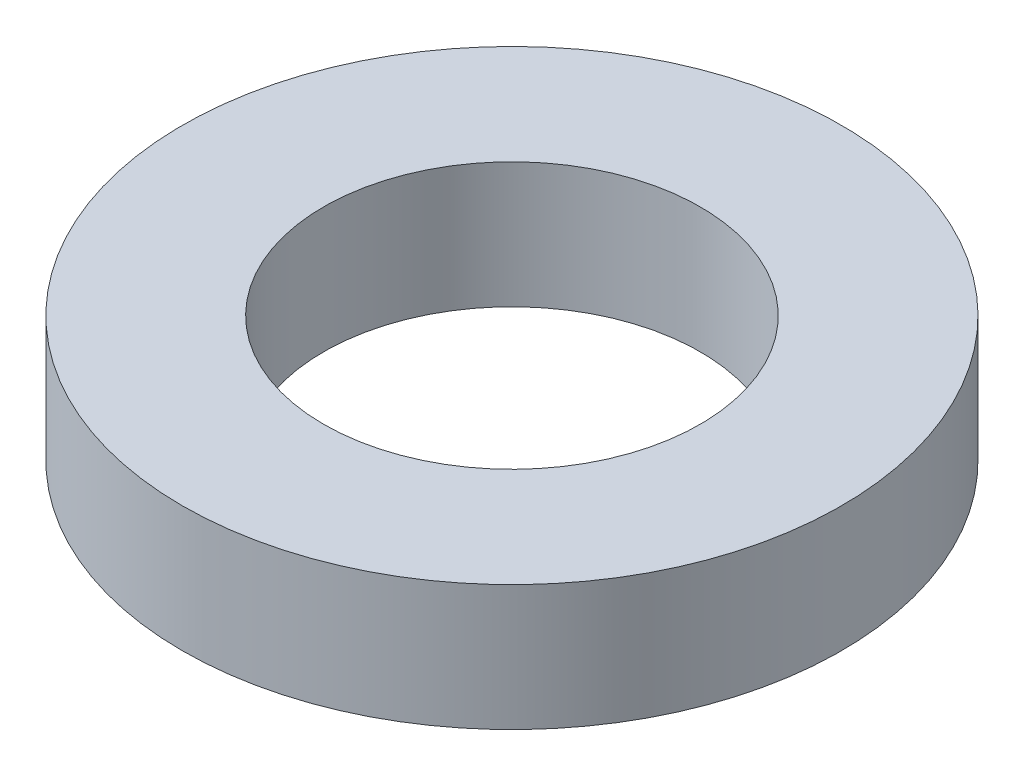
from build123d import *

# Parameters (mm, degrees)
SKETCH1_R           = 52.5
BOSS_EXTRUDE1_DEPTH = 20
SKETCH2_R           = 30
CUT_EXTRUDE1_DEPTH  = 77.892782496


with BuildPart() as part:
    # Sketch1 → Boss-Extrude1 (new body)
    with BuildSketch(Plane(origin=(0, 0, 0), x_dir=(1, 0, 0), z_dir=(0, 1, 0))):
        Circle(SKETCH1_R)
    extrude(amount=BOSS_EXTRUDE1_DEPTH)

    # Sketch2 → Cut-Extrude1 (cut, through all)
    with BuildSketch(Plane(origin=(0, 0, 0), x_dir=(1, 0, 0), z_dir=(0, 1, 0))):
        Circle(SKETCH2_R)
    extrude(amount=CUT_EXTRUDE1_DEPTH, mode=Mode.SUBTRACT)


solid = part.part
